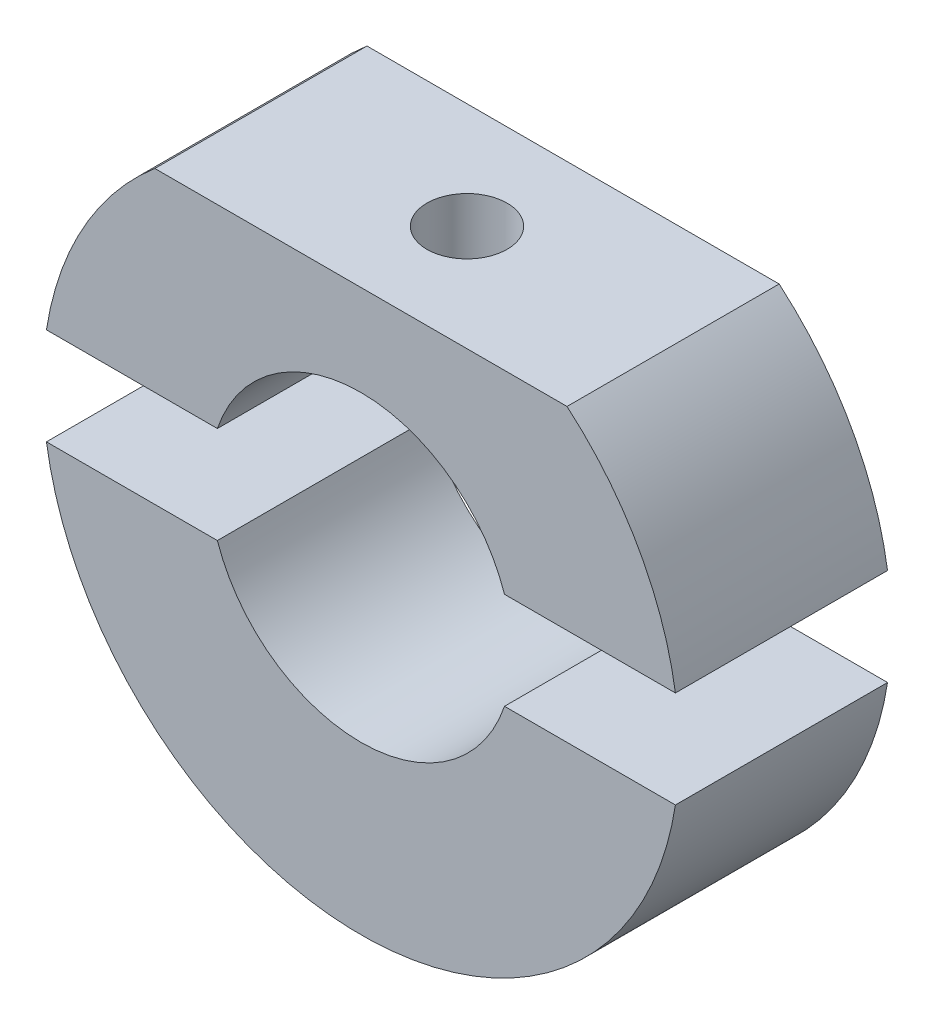
from build123d import *

# Parameters (mm, degrees)
BOSS_EXTRUDE1_DEPTH           = 11.1125
BOSS_EXTRUDE1_2_DEPTH         = 11.1125
M5X0_8_TAPPED_HOLE1_OUTLINE_W = 2.1
M5X0_8_TAPPED_HOLE1_OUTLINE_H = 5.045375368


# Read off the part's stored shape, not the designer's step: M5x0.8 Tapped Hole1
with BuildPart() as part:
    # Sketch1 → Boss-Extrude1 (new body)
    with BuildSketch(Plane.XY):
        with BuildLine():
            ThreePointArc((-7.520126744, 2.54), (0, 7.9375), (7.520126744, 2.54))
            Line((7.520126744, 2.54), (16.474089552, 2.54))
            ThreePointArc((16.474089552, 2.54), (14.550708782, 8.131672676), (10.796167216, 12.7))
            Line((10.796167216, 12.7), (-10.796167216, 12.7))
            ThreePointArc((-10.796167216, 12.7), (-14.550708782, 8.131672676), (-16.474089552, 2.54))
            Line((-16.474089552, 2.54), (-7.520126744, 2.54))
        make_face()
    extrude(amount=BOSS_EXTRUDE1_DEPTH)

    # M5x0.8 Tapped Hole1 outline → M5x0.8 Tapped Hole1 (revolve, cut)
    with BuildSketch(Plane.XY.offset(5.55625)):
        with Locations((1.05, 10.177312316)):
            Rectangle(M5X0_8_TAPPED_HOLE1_OUTLINE_W, M5X0_8_TAPPED_HOLE1_OUTLINE_H)
    revolve(axis=Axis((0, 0, 5.55625), (0, 1, 0)), mode=Mode.SUBTRACT)


with BuildPart() as body_2:
    # Sketch1 → Boss-Extrude1 2 (new body)
    with BuildSketch(Plane.XY):
        with BuildLine():
            Line((16.474089552, -2.54), (7.520126744, -2.54))
            ThreePointArc((7.520126744, -2.54), (0, -7.9375), (-7.520126744, -2.54))
            Line((-7.520126744, -2.54), (-16.474089552, -2.54))
            ThreePointArc((-16.474089552, -2.54), (0, -16.66875), (16.474089552, -2.54))
        make_face()
    extrude(amount=BOSS_EXTRUDE1_2_DEPTH)


solid = Compound([part.part, body_2.part])
